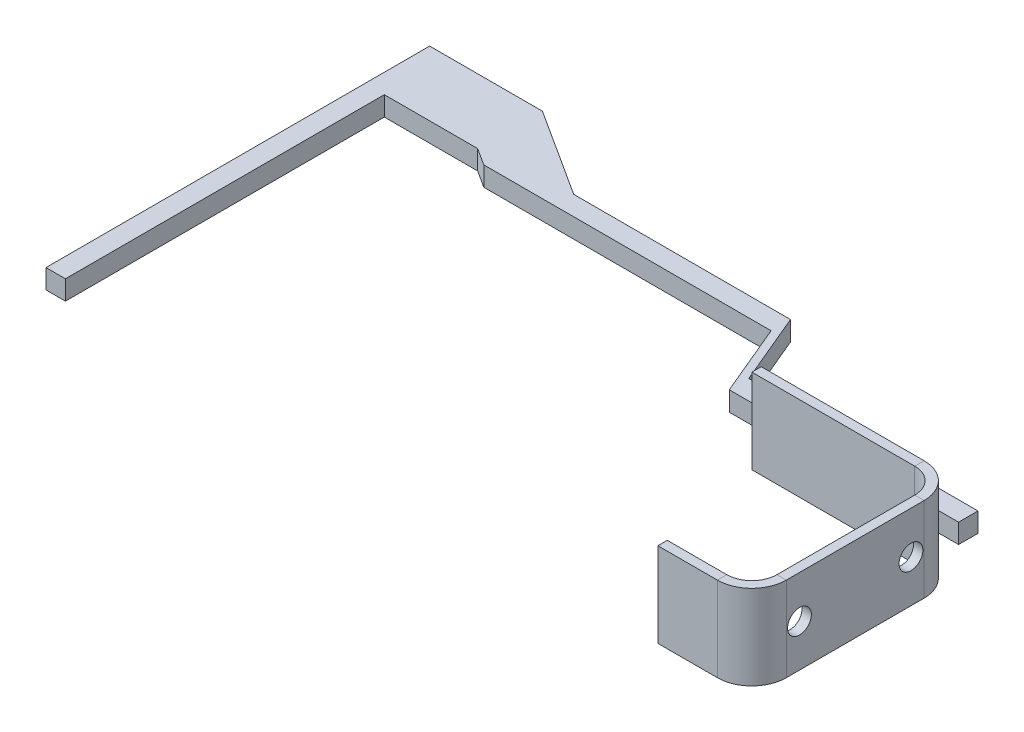
from build123d import *

# Parameters (mm, degrees)
SZKIC2_W                           = 16.5
SZKIC2_H                           = 6.75
ODGI_CIE_BAZOWE1_DEPTH             = 0.75
ODGI_CIE_KRAW_DZI1_STRIP_W         = 7
ODGI_CIE_KRAW_DZI1_STRIP_H         = 0.75
ODGI_CIE_KRAW_DZI1_STRIP_CUT_DEPTH = 6.75
ODGI_CIE_KRAW_DZI1_DEPTH           = 6.75
ODGI_CIE_KRAW_DZI2_STRIP_W         = 7
ODGI_CIE_KRAW_DZI2_STRIP_H         = 0.75
ODGI_CIE_KRAW_DZI2_STRIP_CUT_DEPTH = 6.75
ODGI_CIE_KRAW_DZI2_DEPTH           = 6.75
SZKIC16_W                          = 18.3
SZKIC16_H                          = 1.55
DODANIE_WYCI_GNI_CIE2_DEPTH        = 1.55
DODANIE_WYCI_GNI_CIE3_DEPTH        = 1.55
SZKIC19_R                          = 0.95
WYTNIJ_WYCI_GNI_CIE1_DEPTH         = 0.75


# Sheet-metal steps are written as plain solids
with BuildPart() as part:
    # Szkic2 → Odgięcie bazowe1 (new body)
    with BuildSketch(Plane(origin=(0, 0, 0), x_dir=(0, 0, -1), z_dir=(1, 0, 0))):
        with Locations((-5.0166528, -4.366319951)):
            Rectangle(SZKIC2_W, SZKIC2_H)
    extrude(amount=-ODGI_CIE_BAZOWE1_DEPTH)

    # Odgięcie krawędzi1 strip (across the edge) → Odgięcie krawędzi1 strip cut (cut)
    with BuildSketch(Plane(origin=(-0.75, -7.741319951, 13.2666528), x_dir=(0, 0, -1), z_dir=(0, 1, 0))):
        with Locations((-0.75, -0.375)):
            Rectangle(ODGI_CIE_KRAW_DZI1_STRIP_W, ODGI_CIE_KRAW_DZI1_STRIP_H)
    extrude(amount=ODGI_CIE_KRAW_DZI1_STRIP_CUT_DEPTH, mode=Mode.SUBTRACT)

    # Odgięcie krawędzi1 section (across the edge) → Odgięcie krawędzi1 (add)
    with BuildSketch(Plane(origin=(-0.75, -7.741319951, 13.2666528), x_dir=(0, 0, -1), z_dir=(0, 1, 0))):
        with BuildLine():
            Line((0, 2), (0, 6.75))
            Line((0, 6.75), (0.75, 6.75))
            Line((0.75, 6.75), (0.75, 2))
            ThreePointArc((0.75, 2), (1.335786438, 0.585786438), (2.75, 0))
            Line((2.75, 0), (2.75, -0.75))
            ThreePointArc((2.75, -0.75), (0.805456352, 0.055456352), (0, 2))
        make_face()
    extrude(amount=ODGI_CIE_KRAW_DZI1_DEPTH)

    # Odgięcie krawędzi2 strip (across the edge) → Odgięcie krawędzi2 strip cut (cut)
    with BuildSketch(Plane(origin=(-0.75, -0.991319951, -3.2333472), x_dir=(0, 0, 1), z_dir=(0, -1, 0))):
        with Locations((-0.75, -0.375)):
            Rectangle(ODGI_CIE_KRAW_DZI2_STRIP_W, ODGI_CIE_KRAW_DZI2_STRIP_H)
    extrude(amount=ODGI_CIE_KRAW_DZI2_STRIP_CUT_DEPTH, mode=Mode.SUBTRACT)

    # Odgięcie krawędzi2 section (across the edge) → Odgięcie krawędzi2 (add)
    with BuildSketch(Plane(origin=(-0.75, -0.991319951, -3.2333472), x_dir=(0, 0, 1), z_dir=(0, -1, 0))):
        with BuildLine():
            Line((0, 2), (0, 15))
            Line((0, 15), (0.75, 15))
            Line((0.75, 15), (0.75, 2))
            ThreePointArc((0.75, 2), (1.335786438, 0.585786438), (2.75, 0))
            Line((2.75, 0), (2.75, -0.75))
            ThreePointArc((2.75, -0.75), (0.805456352, 0.055456352), (0, 2))
        make_face()
    extrude(amount=ODGI_CIE_KRAW_DZI2_DEPTH)

    # Szkic16 → Dodanie-wyciągnięcie2 (add)
    with BuildSketch(Plane(origin=(0, 0, -3.2333472), x_dir=(-1, 0, 0), z_dir=(0, 0, -1))):
        with Locations((9.15, -4.636679938)):
            Rectangle(SZKIC16_W, SZKIC16_H)
    extrude(amount=DODANIE_WYCI_GNI_CIE2_DEPTH)

    # Szkic18 → Dodanie-wyciągnięcie3 (add)
    with BuildSketch(Plane(origin=(0, -3.861679938, 0), x_dir=(1, 0, 0), z_dir=(0, 1, 0))):
        Polygon((-45.013147785, 15.032481597), (-54.013147785, 15.032481597), (-54.013147785, -15.585696439), (-52.463147785, -15.585696439), (-52.463147785, 9.864303561), (-45.013147785, 9.864303561), (-43.64142473, 8.982481597), (-20.713147785, 8.982481597), (-18.3, 3.2333472), (-18.3, 4.7833472), (-20.713147785, 10.532481597), (-38.013147785, 10.532481597), align=None)
    extrude(amount=-DODANIE_WYCI_GNI_CIE3_DEPTH)

    # Szkic19 → Wytnij-wyciągnięcie1 (cut)
    with BuildSketch(Plane(origin=(0, 0, 0), x_dir=(0, 0, -1), z_dir=(1, 0, 0))):
        with Locations((-0.5666528, -4.366319951)):
            Circle(SZKIC19_R)
        with Locations((-9.464367913, -4.366319951)):
            Circle(SZKIC19_R)
    extrude(amount=-WYTNIJ_WYCI_GNI_CIE1_DEPTH, mode=Mode.SUBTRACT)


solid = part.part
